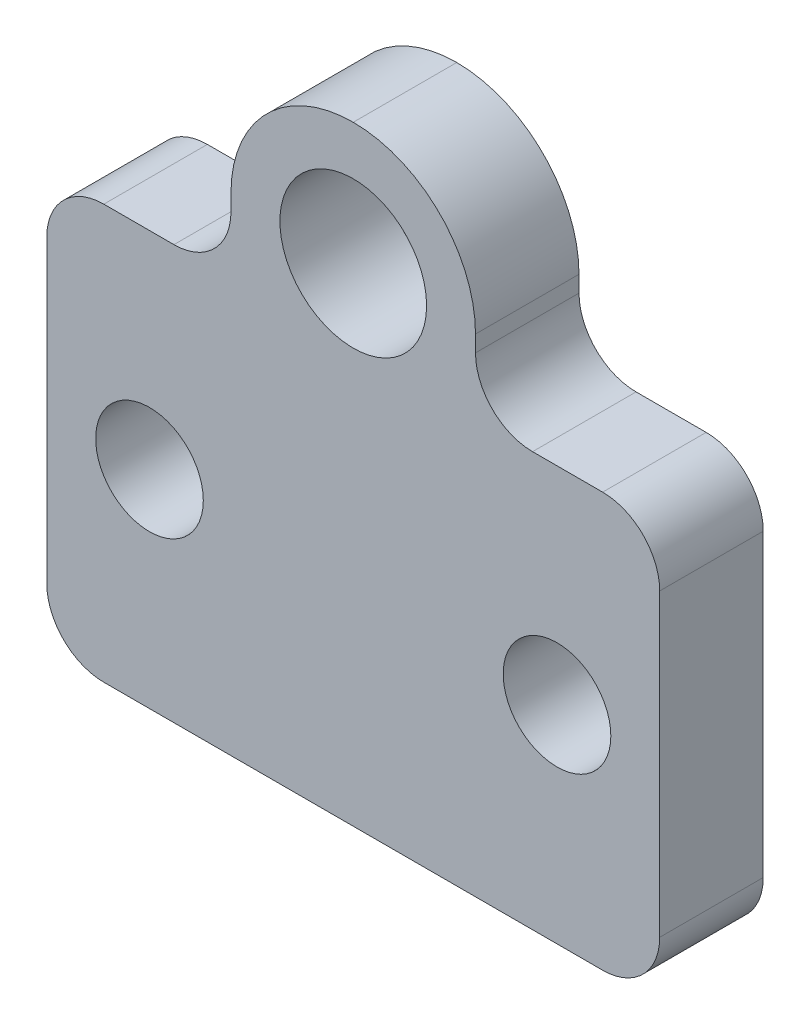
from build123d import *
from OCP.BRepFilletAPI import BRepFilletAPI_MakeFillet

# Parameters (mm, degrees)
SKETCH1_R           = 4.5
SKETCH1_R_2         = 3.302
BOSS_EXTRUDE1_DEPTH = 6.35
FILLET2_R           = 7.5
FILLET2_R_2         = 3.5


with BuildPart() as part:
    # Sketch1 → Boss-Extrude1 (new body)
    with BuildSketch(Plane.XY):
        Polygon((0, 0), (37.6, 0), (37.6, 25.4), (26.3, 25.4), (26.3, 37.4), (11.3, 37.4), (11.3, 25.4), (0, 25.4), align=None)
        with Locations((18.8, 29.9)):
            Circle(SKETCH1_R, mode=Mode.SUBTRACT)
        with Locations((6.3, 12.7)):
            Circle(SKETCH1_R_2, mode=Mode.SUBTRACT)
        with Locations((31.3, 12.7)):
            Circle(SKETCH1_R_2, mode=Mode.SUBTRACT)
    extrude(amount=BOSS_EXTRUDE1_DEPTH)

    # Fillet2
    fillet2_edges_1 = [part.edges().sort_by_distance(p)[0] for p in [
        (11.3, 37.4, 3.175),
        (26.3, 37.4, 3.175),
    ]]
    fillet2_edges_2 = [part.edges().sort_by_distance(p)[0] for p in [
        (11.3, 25.4, 3.175),
        (0, 25.4, 3.175),
        (0, 0, 3.175),
        (37.6, 25.4, 3.175),
        (26.3, 25.4, 3.175),
        (37.6, 0, 3.175),
    ]]
    fillet2 = BRepFilletAPI_MakeFillet(part.part.solid().wrapped)
    for e in fillet2_edges_1:
        fillet2.Add(FILLET2_R - 0.0001, e.wrapped)
    for e in fillet2_edges_2:
        fillet2.Add(FILLET2_R_2 - 0.0001, e.wrapped)
    add(Compound.cast(fillet2.Shape()), mode=Mode.REPLACE)  # a hair under: the kernel refuses the full size


solid = part.part
